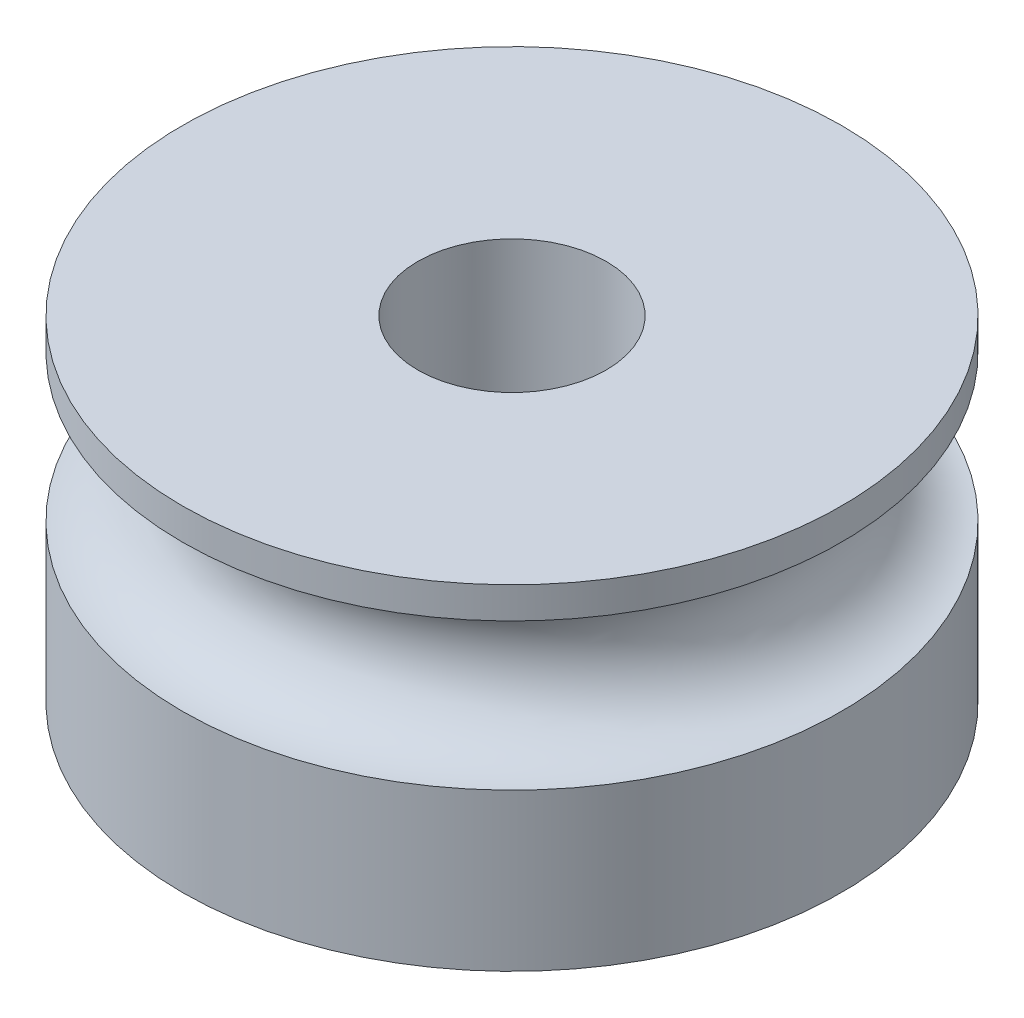
from build123d import *

# Parameters (mm, degrees)
SKETCH1_R           = 7.875
SKETCH1_R_2         = 2.25
BOSS_EXTRUDE1_DEPTH = 8
SKETCH3_R           = 4
CUT_EXTRUDE2_DEPTH  = 3
SKETCH11_R          = 1.75


with BuildPart() as part:
    # Sketch1 → Boss-Extrude1 (new body)
    with BuildSketch(Plane(origin=(0, 0, 0), x_dir=(1, 0, 0), z_dir=(0, 1, 0))):
        Circle(SKETCH1_R)
        Circle(SKETCH1_R_2, mode=Mode.SUBTRACT)
    extrude(amount=BOSS_EXTRUDE1_DEPTH)

    # Sketch3 → Cut-Extrude2 (cut)
    with BuildSketch(Plane(origin=(0, 0, 0), x_dir=(-1, 0, 0), z_dir=(0, -1, 0))):
        Circle(SKETCH3_R)
    extrude(amount=-CUT_EXTRUDE2_DEPTH, mode=Mode.SUBTRACT)

    # Sketch11 → Cut-Revolve1 (revolve, cut)
    with BuildSketch(Plane.XY):
        with Locations((-7.875, 5.5)):
            Circle(SKETCH11_R)
    revolve(axis=Axis((0, 0, 0), (0, 1, 0)), mode=Mode.SUBTRACT)


solid = part.part
